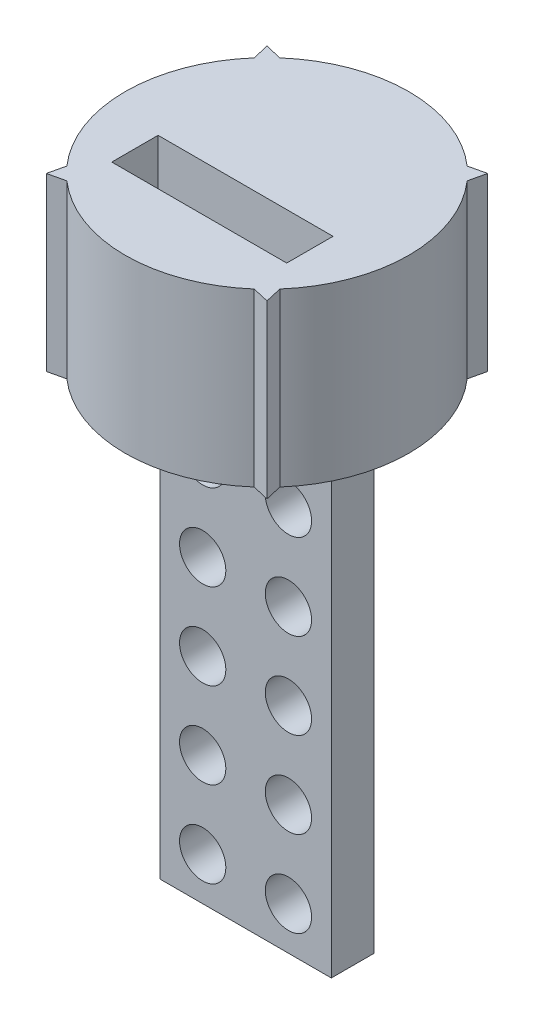
from build123d import *

# Parameters (mm, degrees)
BOSS_EXTRUDE1_DEPTH = 25.4
SKETCH3_W           = 25.4
SKETCH3_H           = 69.85
SKETCH3_R           = 3.429
BOSS_EXTRUDE3_DEPTH = 3.175
SKETCH4_W           = 25.908
SKETCH4_H           = 6.858
CUT_EXTRUDE1_DEPTH  = 76.901399855
FILLET2_R           = 5.08


with BuildPart() as part:
    # Sketch1 → Boss-Extrude1 (new body)
    with BuildSketch(Plane(origin=(0, 0, 0), x_dir=(1, 0, 0), z_dir=(0, 1, 0))):
        with BuildLine():
            Line((13.870085237, 15.767711804), (16.343875029, 16.343875029))
            Line((16.343875029, 16.343875029), (15.767711804, 13.870085237))
            ThreePointArc((15.767711804, 13.870085237), (21, 0), (15.767711804, -13.870085237))
            Line((15.767711804, -13.870085237), (16.343875029, -16.343875029))
            Line((16.343875029, -16.343875029), (13.870085237, -15.767711804))
            ThreePointArc((13.870085237, -15.767711804), (0, -21), (-13.870085237, -15.767711804))
            Line((-13.870085237, -15.767711804), (-16.343875029, -16.343875029))
            Line((-16.343875029, -16.343875029), (-15.767711804, -13.870085237))
            ThreePointArc((-15.767711804, -13.870085237), (-21, 0), (-15.767711804, 13.870085237))
            Line((-15.767711804, 13.870085237), (-16.343875029, 16.343875029))
            Line((-16.343875029, 16.343875029), (-13.870085237, 15.767711804))
            ThreePointArc((-13.870085237, 15.767711804), (0, 21), (13.870085237, 15.767711804))
        make_face()
    extrude(amount=BOSS_EXTRUDE1_DEPTH)

    # Sketch3 → Boss-Extrude3 (add, symmetric)
    with BuildSketch(Plane.XY):
        with Locations((0, -34.925)):
            Rectangle(SKETCH3_W, SKETCH3_H)
        with Locations((-6.35, -12.7)):
            Circle(SKETCH3_R, mode=Mode.SUBTRACT)
        with Locations((6.35, -12.7)):
            Circle(SKETCH3_R, mode=Mode.SUBTRACT)
        with Locations((6.35, -25.4)):
            Circle(SKETCH3_R, mode=Mode.SUBTRACT)
        with Locations((6.35, -38.1)):
            Circle(SKETCH3_R, mode=Mode.SUBTRACT)
        with Locations((6.35, -50.8)):
            Circle(SKETCH3_R, mode=Mode.SUBTRACT)
        with Locations((6.35, -63.5)):
            Circle(SKETCH3_R, mode=Mode.SUBTRACT)
        with Locations((-6.35, -25.4)):
            Circle(SKETCH3_R, mode=Mode.SUBTRACT)
        with Locations((-6.35, -38.1)):
            Circle(SKETCH3_R, mode=Mode.SUBTRACT)
        with Locations((-6.35, -50.8)):
            Circle(SKETCH3_R, mode=Mode.SUBTRACT)
        with Locations((-6.35, -63.5)):
            Circle(SKETCH3_R, mode=Mode.SUBTRACT)
    extrude(amount=BOSS_EXTRUDE3_DEPTH, both=True)

    # Sketch4 → Cut-Extrude1 (cut, through all)
    with BuildSketch(Plane(origin=(0, 0, 0), x_dir=(-1, 0, 0), z_dir=(0, -1, 0))):
        with Locations((0, -6.604)):
            Rectangle(SKETCH4_W, SKETCH4_H)
    extrude(amount=-CUT_EXTRUDE1_DEPTH, mode=Mode.SUBTRACT)

    # Fillet2
    # the kernel refuses this fillet: 5.08 mm, written as the material it adds along each edge
    with BuildSketch(Plane(origin=(-12.7, 0, -3.175), x_dir=(-1, 0, 0), z_dir=(0, 0, 1)), Plane(origin=(12.7, 0, 3.175), x_dir=(1, 0, 0), z_dir=(0, 0, -1))) as fillet2_piece_1:
        with BuildLine():
            CenterArc((FILLET2_R, FILLET2_R), FILLET2_R, 180, 90)
            Line((0, FILLET2_R), (-FILLET2_R * 0.02, FILLET2_R))
            Line((-FILLET2_R * 0.02, FILLET2_R), (-FILLET2_R * 0.02, -FILLET2_R * 0.02))
            Line((-FILLET2_R * 0.02, -FILLET2_R * 0.02), (FILLET2_R, -FILLET2_R * 0.02))
            Line((FILLET2_R, -FILLET2_R * 0.02), (FILLET2_R, 0))
        make_face()
    extrude(amount=6.35)
    with BuildSketch(Plane(origin=(-12.7, 0, -3.175), x_dir=(0, 0, -1), z_dir=(1, 0, 0))) as fillet2_piece_2:
        with BuildLine():
            CenterArc((FILLET2_R, -FILLET2_R), FILLET2_R, 90, 90)
            Line((0, -FILLET2_R), (-FILLET2_R * 0.02, -FILLET2_R))
            Line((-FILLET2_R * 0.02, -FILLET2_R), (-FILLET2_R * 0.02, FILLET2_R * 0.02))
            Line((-FILLET2_R * 0.02, FILLET2_R * 0.02), (FILLET2_R, FILLET2_R * 0.02))
            Line((FILLET2_R, FILLET2_R * 0.02), (FILLET2_R, 0))
        make_face()
    extrude(amount=25.4)
    with BuildSketch(Plane(origin=(-25.4, 0, -3.175), x_dir=(0, 0, -1), z_dir=(1, 0, 0))) as fillet2_piece_3a_section:
        with BuildLine():
            CenterArc((FILLET2_R, -FILLET2_R), FILLET2_R, 90, 90)
            Line((0, -FILLET2_R), (-FILLET2_R * 0.02, -FILLET2_R))
            Line((-FILLET2_R * 0.02, -FILLET2_R), (-FILLET2_R * 0.02, FILLET2_R * 0.02))
            Line((-FILLET2_R * 0.02, FILLET2_R * 0.02), (FILLET2_R, FILLET2_R * 0.02))
            Line((FILLET2_R, FILLET2_R * 0.02), (FILLET2_R, 0))
        make_face()
    fillet2_piece_3a = extrude(amount=38.1, mode=Mode.PRIVATE)
    fillet2_piece_3a = split(fillet2_piece_3a, bisect_by=Plane(origin=(-12.7, -1.15008718, -4.32508718), z_dir=(-1, 0, 0)), keep=Keep.TOP, mode=Mode.PRIVATE)
    with BuildSketch(Plane(origin=(-12.7, 0, -15.875), x_dir=(-1, 0, 0), z_dir=(0, 0, 1))) as fillet2_piece_3b_section:
        with BuildLine():
            CenterArc((FILLET2_R, FILLET2_R), FILLET2_R, 180, 90)
            Line((0, FILLET2_R), (-FILLET2_R * 0.02, FILLET2_R))
            Line((-FILLET2_R * 0.02, FILLET2_R), (-FILLET2_R * 0.02, -FILLET2_R * 0.02))
            Line((-FILLET2_R * 0.02, -FILLET2_R * 0.02), (FILLET2_R, -FILLET2_R * 0.02))
            Line((FILLET2_R, -FILLET2_R * 0.02), (FILLET2_R, 0))
        make_face()
    fillet2_piece_3b = extrude(amount=19.05, mode=Mode.PRIVATE)
    fillet2_piece_3b = split(fillet2_piece_3b, bisect_by=Plane(origin=(-13.85008718, -1.15008718, -3.175), z_dir=(0, 0, -1)), keep=Keep.TOP, mode=Mode.PRIVATE)
    fillet2_piece_3 = fillet2_piece_3a & fillet2_piece_3b
    add(fillet2_piece_3)
    with BuildSketch(Plane(origin=(-12.7, 0, -3.175), x_dir=(0, 0, -1), z_dir=(1, 0, 0))) as fillet2_piece_4a_section:
        with BuildLine():
            CenterArc((FILLET2_R, -FILLET2_R), FILLET2_R, 90, 90)
            Line((0, -FILLET2_R), (-FILLET2_R * 0.02, -FILLET2_R))
            Line((-FILLET2_R * 0.02, -FILLET2_R), (-FILLET2_R * 0.02, FILLET2_R * 0.02))
            Line((-FILLET2_R * 0.02, FILLET2_R * 0.02), (FILLET2_R, FILLET2_R * 0.02))
            Line((FILLET2_R, FILLET2_R * 0.02), (FILLET2_R, 0))
        make_face()
    fillet2_piece_4a = extrude(amount=38.1, mode=Mode.PRIVATE)
    fillet2_piece_4a = split(fillet2_piece_4a, bisect_by=Plane(origin=(12.7, -1.15008718, -4.32508718), z_dir=(1, 0, 0)), keep=Keep.TOP, mode=Mode.PRIVATE)
    with BuildSketch(Plane(origin=(12.7, 0, 3.175), x_dir=(1, 0, 0), z_dir=(0, 0, -1))) as fillet2_piece_4b_section:
        with BuildLine():
            CenterArc((FILLET2_R, FILLET2_R), FILLET2_R, 180, 90)
            Line((0, FILLET2_R), (-FILLET2_R * 0.02, FILLET2_R))
            Line((-FILLET2_R * 0.02, FILLET2_R), (-FILLET2_R * 0.02, -FILLET2_R * 0.02))
            Line((-FILLET2_R * 0.02, -FILLET2_R * 0.02), (FILLET2_R, -FILLET2_R * 0.02))
            Line((FILLET2_R, -FILLET2_R * 0.02), (FILLET2_R, 0))
        make_face()
    fillet2_piece_4b = extrude(amount=19.05, mode=Mode.PRIVATE)
    fillet2_piece_4b = split(fillet2_piece_4b, bisect_by=Plane(origin=(13.85008718, -1.15008718, -3.175), z_dir=(0, 0, -1)), keep=Keep.TOP, mode=Mode.PRIVATE)
    fillet2_piece_4 = fillet2_piece_4a & fillet2_piece_4b
    add(fillet2_piece_4)


solid = part.part
